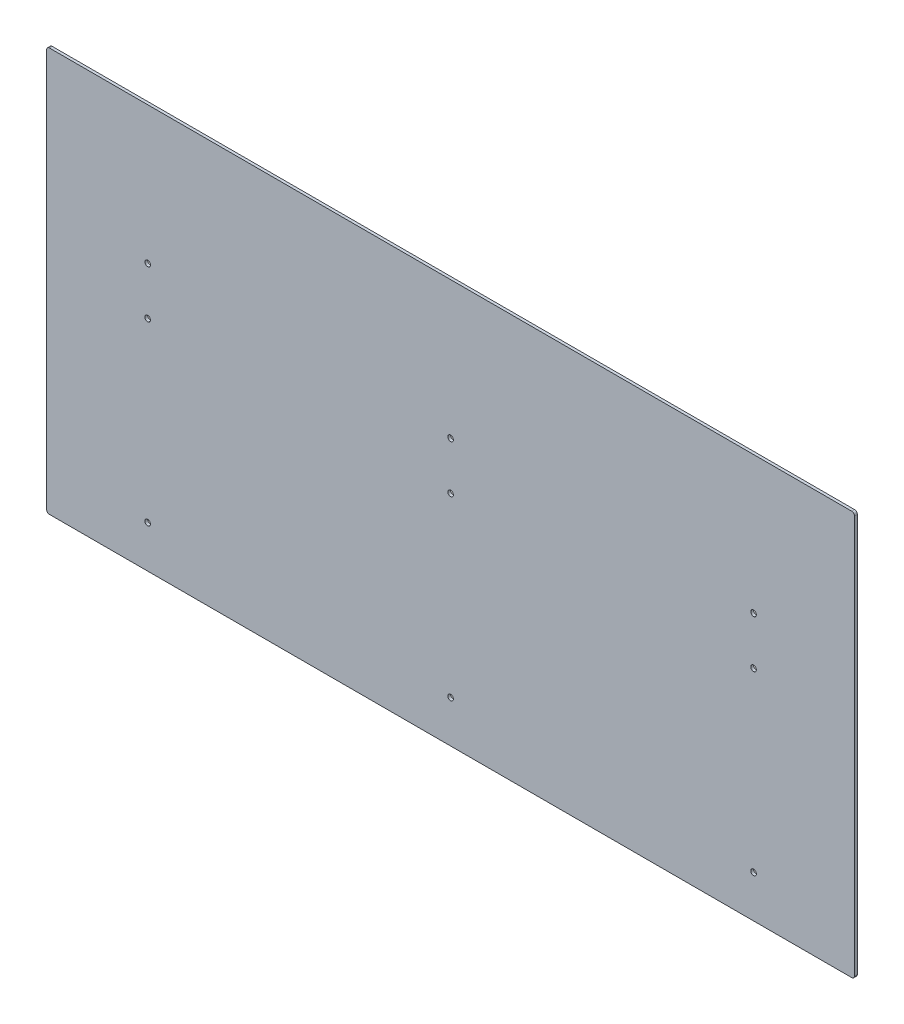
from build123d import *

# Parameters (mm, degrees)
SKETCH1_W                   = 914.4
SKETCH1_H                   = 457.2
BOSS_EXTRUDE1_DEPTH         = 3.175
F_1_4_0_25_DIAMETER_HOLE1_D = 6.35
FILLET1_R                   = 3.175


with BuildPart() as part:
    # Sketch1 → Boss-Extrude1 (new body)
    with BuildSketch(Plane.XY):
        with Locations((457.2, 228.6)):
            Rectangle(SKETCH1_W, SKETCH1_H)
    extrude(amount=BOSS_EXTRUDE1_DEPTH)

    # 1/4 (0.25) Diameter Hole1 (through all)
    with Locations(Plane.XY.offset(3.175)):
        with Locations((114.3, 247.65), (114.3, 301.625), (457.2, 301.625), (457.2, 247.65), (800.1, 247.65), (800.1, 301.625), (114.3, 47.625), (457.2, 47.625), (800.1, 47.625)):
            Hole(F_1_4_0_25_DIAMETER_HOLE1_D / 2)

    # Fillet1
    fillet1_edges = [part.edges().sort_by_distance(p)[0] for p in [
        (914.4, 457.2, 1.5875),
        (914.4, 0, 1.5875),
        (0, 0, 1.5875),
        (0, 457.2, 1.5875),
    ]]
    fillet(fillet1_edges, radius=FILLET1_R)


solid = part.part
